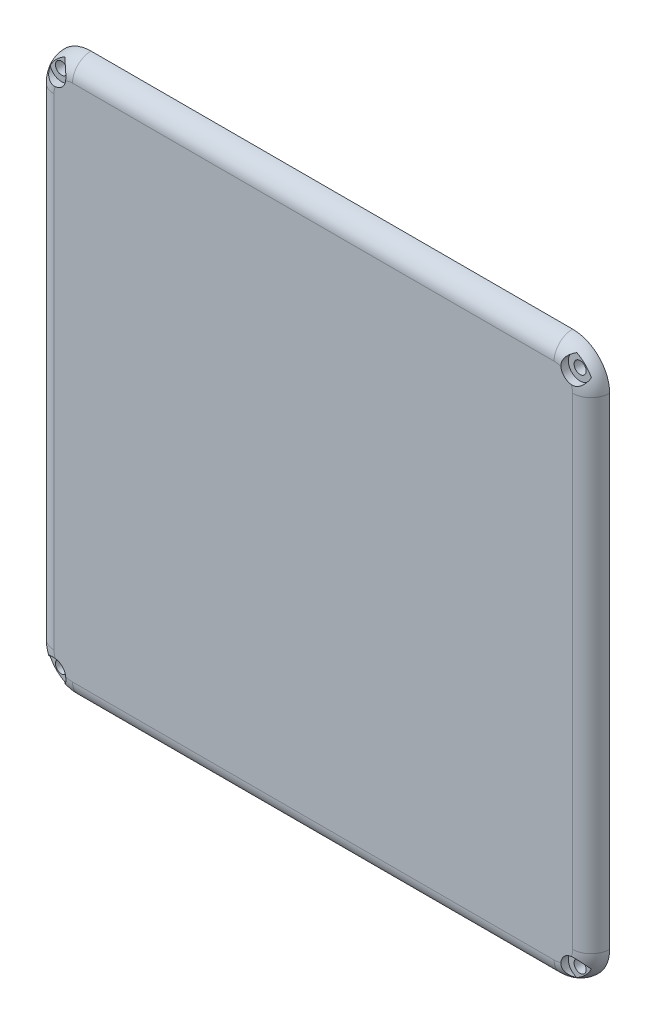
from build123d import *

# Parameters (mm, degrees)
CROQUIS1_W                                           = 150
CROQUIS1_H                                           = 150
SALIENTE_EXTRUIR1_DEPTH                              = 5
REDONDEO1_R                                          = 10
REDONDEO3_R                                          = 5
REFRENTADO_PARA_TORNILLO_CON_CABEZA_TRON_D           = 3.2639
REFRENTADO_PARA_TORNILLO_CON_CABEZA_TRON_DEPTH       = 50
REFRENTADO_PARA_TORNILLO_CON_CABEZA_TRON_CBORE_D     = 6.35
REFRENTADO_PARA_TORNILLO_CON_CABEZA_TRON_CBORE_DEPTH = 2.032
REFRENTADO_PARA_TORNILLO_CON_CABEZA_TRON_TIP         = 0.980574487


with BuildPart() as part:
    # Croquis1 → Saliente-Extruir1 (new body)
    with BuildSketch(Plane.XY):
        Rectangle(CROQUIS1_W, CROQUIS1_H)
    extrude(amount=SALIENTE_EXTRUIR1_DEPTH)

    # Redondeo1
    redondeo1_edges = [part.edges().sort_by_distance(p)[0] for p in [
        (75, -75, 2.5),
        (-75, -75, 2.5),
        (-75, 75, 2.5),
        (75, 75, 2.5),
    ]]
    fillet(redondeo1_edges, radius=REDONDEO1_R)

    # Redondeo3
    redondeo3_edges = [part.edges().sort_by_distance(p)[0] for p in [
        (72.071067812, 72.071067812, 5),
        (75, 0, 5),
        (72.071067812, -72.071067812, 5),
        (0, -75, 5),
        (-72.071067812, -72.071067812, 5),
        (-75, 0, 5),
        (-72.071067812, 72.071067812, 5),
        (0, 75, 5),
    ]]
    fillet(redondeo3_edges, radius=REDONDEO3_R - 0.0001)  # a hair under: the kernel refuses the full size

    # Refrentado para tornillo con cabeza troncocónica de #41
    with Locations(Plane.XY.offset(5)):
        with Locations((-70, 70), (-70, -70), (70, -70), (70, 70)):
            CounterBoreHole(REFRENTADO_PARA_TORNILLO_CON_CABEZA_TRON_D / 2, REFRENTADO_PARA_TORNILLO_CON_CABEZA_TRON_CBORE_D / 2, REFRENTADO_PARA_TORNILLO_CON_CABEZA_TRON_CBORE_DEPTH, depth=REFRENTADO_PARA_TORNILLO_CON_CABEZA_TRON_DEPTH)
            with Locations((0, 0, -(REFRENTADO_PARA_TORNILLO_CON_CABEZA_TRON_DEPTH + REFRENTADO_PARA_TORNILLO_CON_CABEZA_TRON_TIP / 2))):  # 118° drill point
                Cone(0, REFRENTADO_PARA_TORNILLO_CON_CABEZA_TRON_D / 2, REFRENTADO_PARA_TORNILLO_CON_CABEZA_TRON_TIP, mode=Mode.SUBTRACT)


solid = part.part
